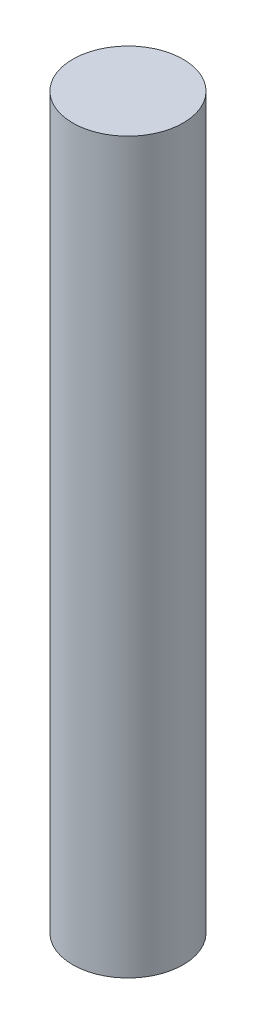
from build123d import *

# Parameters (mm, degrees)
SKETCH1_R           = 5
BOSS_EXTRUDE1_DEPTH = 66


with BuildPart() as part:
    # Sketch1 → Boss-Extrude1 (new body)
    with BuildSketch(Plane(origin=(0, 0, 0), x_dir=(1, 0, 0), z_dir=(0, 1, 0))):
        Circle(SKETCH1_R)
    extrude(amount=BOSS_EXTRUDE1_DEPTH)


solid = part.part
